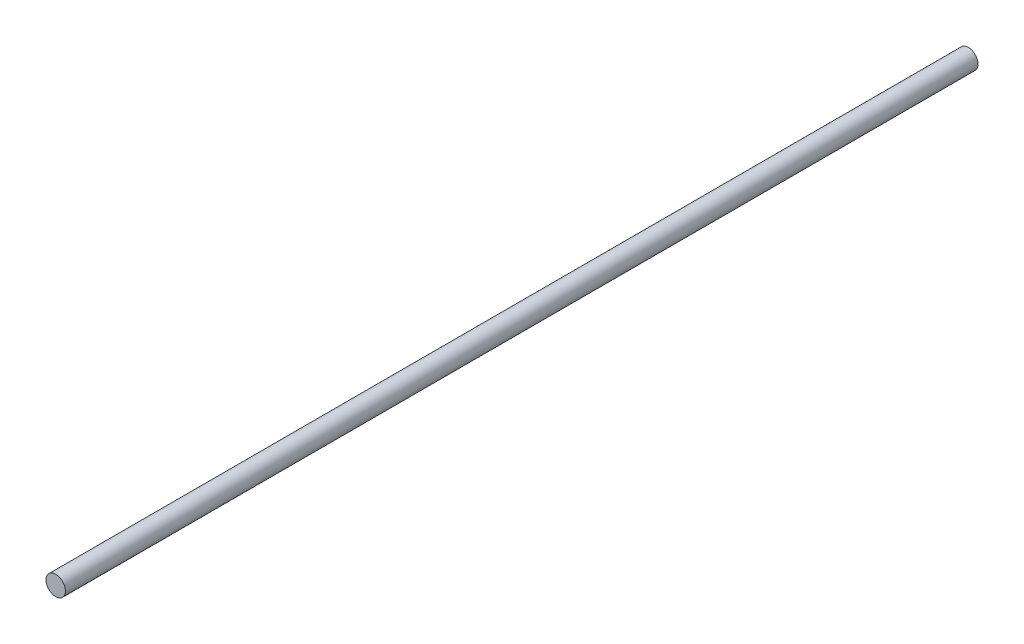
from build123d import *

# Parameters (mm, degrees)
SKETCH1_R           = 2.5
BOSS_EXTRUDE1_DEPTH = 117.5


with BuildPart() as part:
    # Sketch1 → Boss-Extrude1 (new, symmetric)
    with BuildSketch(Plane.XY):
        Circle(SKETCH1_R)
    extrude(amount=BOSS_EXTRUDE1_DEPTH, both=True)


solid = part.part
